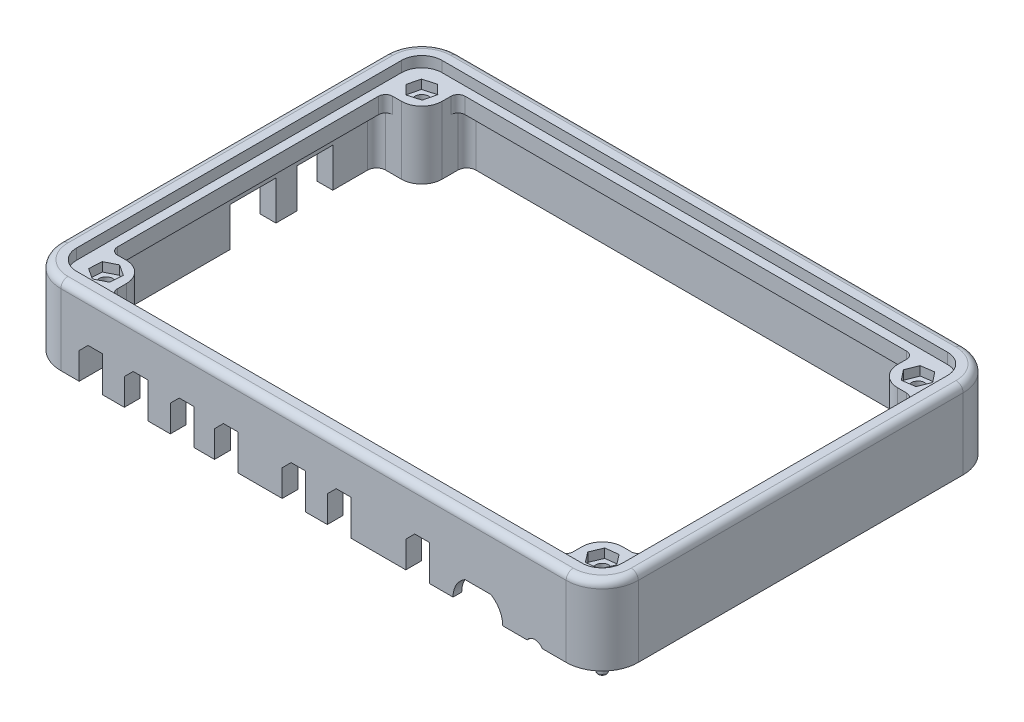
from build123d import *

# Parameters (mm, degrees)
BOSS_EXTRUDE1_DEPTH     = 40
SKETCH2_R               = 2.5
SKETCH2_W               = 6.604
SKETCH2_H               = 16
CUT_EXTRUDE1_DEPTH      = 40
SKETCH3_W               = 10
SKETCH3_H               = 12
SKETCH3_W_2             = 13
CUT_EXTRUDE2_DEPTH      = 40
SKETCH4_W               = 179.476967263
SKETCH4_H               = 26.397125059
CUT_EXTRUDE3_DEPTH      = 120
FILLET1_R               = 2
CUT_EXTRUDE5_DEPTH      = 2.9972
SKETCH6_R               = 1.905
CUT_EXTRUDE6_DEPTH      = 25.8572
SKETCH8_R               = 1.27
BOSS_EXTRUDE2_DEPTH     = 2.5
MIRROR2_COPY_1_SKETCH_R = 1.27
MIRROR2_COPY_1_DEPTH    = 2.5
FILLET2_R               = 0.508
CHAMFER1_SIZE           = 2.5
SKETCH9_W               = 133.938725874
SKETCH9_H               = 2.5
SKETCH9_W_2             = 2.5
SKETCH9_H_2             = 84.886391529
SKETCH9_W_3             = 135.162451748
SKETCH9_H_3             = 84.339912614
BOSS_EXTRUDE3_DEPTH     = 4.5
FILLET3_R               = 2
SKETCH13_W              = 21
SKETCH13_H              = 21
CUT_EXTRUDE7_DEPTH      = 2
CUT_EXTRUDE8_DEPTH      = 2.54


with BuildPart() as part:
    # Sketch1 → Boss-Extrude1 (new body)
    with BuildSketch(Plane(origin=(0, 0, 0), x_dir=(1, 0, 0), z_dir=(0, 1, 0))):
        with BuildLine():
            Line((-71.12, 55.88), (71.12, 55.88))
            ThreePointArc((71.12, 55.88), (78.304204897, 52.904204897), (81.28, 45.72))
            Line((81.28, 45.72), (81.28, -45.72))
            ThreePointArc((81.28, -45.72), (78.304204897, -52.904204897), (71.12, -55.88))
            Line((71.12, -55.88), (-71.12, -55.88))
            ThreePointArc((-71.12, -55.88), (-78.304204897, -52.904204897), (-81.28, -45.72))
            Line((-81.28, -45.72), (-81.28, 45.72))
            ThreePointArc((-81.28, 45.72), (-78.304204897, 52.904204897), (-71.12, 55.88))
        make_face()
    extrude(amount=BOSS_EXTRUDE1_DEPTH)

    # Sketch2 → Cut-Extrude1 (cut)
    with BuildSketch(Plane.XY.offset(55.88)):
        with Locations((62.28, 16.68)):
            Circle(SKETCH2_R)
        with BuildLine():
            Line((42.620513585, 23.965662), (49.944686415, 23.965662))
            ThreePointArc((49.944686415, 23.965662), (46.2826, 11), (42.620513585, 23.965662))
        make_face()
        with Locations((-62.658, 20)):
            Rectangle(SKETCH2_W, SKETCH2_H)
        with Locations((-49.958, 20)):
            Rectangle(SKETCH2_W, SKETCH2_H)
        with Locations((-37.004, 20)):
            Rectangle(SKETCH2_W, SKETCH2_H)
        with Locations((-24.558, 20)):
            Rectangle(SKETCH2_W, SKETCH2_H)
        with Locations((-5.508, 20)):
            Rectangle(SKETCH2_W, SKETCH2_H)
        with Locations((7.192, 20)):
            Rectangle(SKETCH2_W, SKETCH2_H)
        with Locations((29.29, 20)):
            Rectangle(SKETCH2_W, SKETCH2_H)
    extrude(amount=-CUT_EXTRUDE1_DEPTH, mode=Mode.SUBTRACT)

    # Sketch3 → Cut-Extrude2 (cut)
    with BuildSketch(Plane.ZY.offset(81.28)):
        with Locations((-21.38, 23)):
            Rectangle(SKETCH3_W, SKETCH3_H)
        with Locations((-3.88, 23)):
            Rectangle(SKETCH3_W_2, SKETCH3_H)
    extrude(amount=-CUT_EXTRUDE2_DEPTH, mode=Mode.SUBTRACT)

    # Sketch4 → Cut-Extrude3 (cut)
    with BuildSketch(Plane.XY.offset(55.88)):
        with Locations((-1.545647641, 4.80143747)):
            Rectangle(SKETCH4_W, SKETCH4_H)
    extrude(amount=-CUT_EXTRUDE3_DEPTH, mode=Mode.SUBTRACT)

    # Fillet1
    fillet1_edges = [part.edges().sort_by_distance(p)[0] for p in [
        (78.304204897, 40, 52.904204897),
        (81.28, 40, 0),
        (78.304204897, 40, -52.904204897),
        (0, 40, -55.88),
        (-78.304204897, 40, -52.904204897),
        (-81.28, 40, 0),
        (-78.304204897, 40, 52.904204897),
        (0, 40, 55.88),
    ]]
    fillet(fillet1_edges, radius=FILLET1_R)

    # Sketch5 → Cut-Extrude5 (cut)
    with BuildSketch(Plane.XZ.offset(-40)):
        with BuildLine():
            Line((-71.12, 51.435), (71.12, 51.435))
            ThreePointArc((71.12, 51.435), (75.161115254, 49.761115254), (76.835, 45.72))
            Line((76.835, 45.72), (76.835, -45.72))
            ThreePointArc((76.835, -45.72), (75.161115254, -49.761115254), (71.12, -51.435))
            Line((71.12, -51.435), (-71.12, -51.435))
            ThreePointArc((-71.12, -51.435), (-75.161115254, -49.761115254), (-76.835, -45.72))
            Line((-76.835, -45.72), (-76.835, 45.72))
            ThreePointArc((-76.835, 45.72), (-75.161115254, 49.761115254), (-71.12, 51.435))
        make_face()
    extrude(amount=CUT_EXTRUDE5_DEPTH, mode=Mode.SUBTRACT)

    # Sketch6 → Cut-Extrude6 (cut)
    with BuildSketch(Plane(origin=(0, 37.0028, 0), x_dir=(1, 0, 0), z_dir=(0, 1, 0))):
        with Locations(Location((-69.85, 44.45, 0), (0, 0, 270))):
            Circle(SKETCH6_R)
        with Locations(Location((69.85, 44.45, 0), (0, 0, 270))):
            Circle(SKETCH6_R)
        with Locations(Location((69.85, -44.45, 0), (0, 0, 270))):
            Circle(SKETCH6_R)
        with Locations(Location((-69.85, -44.45, 0), (0, 0, 270))):
            Circle(SKETCH6_R)
        with BuildLine():
            Line((-61.595, 51.435), (61.595, 51.435))
            ThreePointArc((61.595, 51.435), (63.391051224, 50.691051224), (64.135, 48.895))
            Line((64.135, 48.895), (64.135, 44.45))
            ThreePointArc((64.135, 44.45), (65.808884746, 40.408884746), (69.85, 38.735))
            Line((69.85, 38.735), (74.295, 38.735))
            ThreePointArc((74.295, 38.735), (76.091051224, 37.991051224), (76.835, 36.195))
            Line((76.835, 36.195), (76.835, -36.195))
            ThreePointArc((76.835, -36.195), (76.091051224, -37.991051224), (74.295, -38.735))
            Line((74.295, -38.735), (69.85, -38.735))
            ThreePointArc((69.85, -38.735), (65.808884746, -40.408884746), (64.135, -44.45))
            Line((64.135, -44.45), (64.135, -48.895))
            ThreePointArc((64.135, -48.895), (63.391051224, -50.691051224), (61.595, -51.435))
            Line((61.595, -51.435), (-61.595, -51.435))
            ThreePointArc((-61.595, -51.435), (-63.391051224, -50.691051224), (-64.135, -48.895))
            Line((-64.135, -48.895), (-64.135, -44.45))
            ThreePointArc((-64.135, -44.45), (-65.808884746, -40.408884746), (-69.85, -38.735))
            Line((-69.85, -38.735), (-74.295, -38.735))
            ThreePointArc((-74.295, -38.735), (-76.091051224, -37.991051224), (-76.835, -36.195))
            Line((-76.835, -36.195), (-76.835, 36.195))
            ThreePointArc((-76.835, 36.195), (-76.091051224, 37.991051224), (-74.295, 38.735))
            Line((-74.295, 38.735), (-69.85, 38.735))
            ThreePointArc((-69.85, 38.735), (-65.808884746, 40.408884746), (-64.135, 44.45))
            Line((-64.135, 44.45), (-64.135, 48.895))
            ThreePointArc((-64.135, 48.895), (-63.391051224, 50.691051224), (-61.595, 51.435))
        make_face()
    extrude(amount=-CUT_EXTRUDE6_DEPTH, mode=Mode.SUBTRACT)

    # Sketch8 → Boss-Extrude2 (add)
    with BuildSketch(Plane.XZ.offset(-18)):
        with Locations(Location((-76.2, 50.8, 0), (0, 0, 90))):
            Circle(SKETCH8_R)
    boss_extrude2 = extrude(amount=BOSS_EXTRUDE2_DEPTH)

    # Mirror1: Boss-Extrude2 across plane
    add(boss_extrude2.mirror(Plane.XY))

    # Mirror2: Boss-Extrude2 across plane
    add(boss_extrude2.mirror(Plane(origin=(0, 0, 0), x_dir=(0, 0, 1), z_dir=(1, 0, 0))))

    # Mirror2 copy 1 sketch → Mirror2 copy 1 (add)
    with BuildSketch(Plane(origin=(0, 18, 0), x_dir=(-1, 0, 0), z_dir=(0, -1, 0))):
        with Locations(Location((-76.2, 50.8, 0), (0, 0, 90))):
            Circle(MIRROR2_COPY_1_SKETCH_R)
    extrude(amount=MIRROR2_COPY_1_DEPTH)

    # Fillet2
    fillet2_edges = [part.edges().sort_by_distance(p)[0] for p in [
        (-76.2, 18, 49.53),
        (-76.2, 15.5, 49.53),
        (-76.2, 15.5, -49.53),
        (-76.2, 18, -49.53),
        (76.2, 15.5, 49.53),
        (76.2, 18, 49.53),
        (76.2, 18, -49.53),
        (76.2, 15.5, -49.53),
    ]]
    fillet(fillet2_edges, radius=FILLET2_R)

    # Chamfer1
    chamfer1_edges = [part.edges().sort_by_distance(p)[0] for p in [
        (-65.96, 28, 48.071610106),
        (-53.26, 28, 53.6575),
        (-40.306, 28, 53.6575),
        (-27.86, 28, 53.6575),
        (-8.81, 28, 53.6575),
        (3.89, 28, 53.6575),
        (25.988, 28, 53.6575),
    ]]
    chamfer(chamfer1_edges, length=CHAMFER1_SIZE)

    # Sketch9 → Boss-Extrude3 (add)
    with BuildSketch(Plane(origin=(0, 37.0028, 0), x_dir=(1, 0, 0), z_dir=(0, 1, 0))):
        with Locations((0.611862937, 50.185)):
            Rectangle(SKETCH9_W, SKETCH9_H)
        with Locations((75.585, -1.457277108)):
            Rectangle(SKETCH9_W_2, SKETCH9_H_2)
        with Locations((0, -50.185)):
            Rectangle(SKETCH9_W_3, SKETCH9_H)
        with Locations((-75.585, 0.455399096)):
            Rectangle(SKETCH9_W_2, SKETCH9_H_3)
    extrude(amount=-BOSS_EXTRUDE3_DEPTH)

    # Fillet3
    # the kernel refuses this fillet: 2 mm, written as the material it adds along each edge
    with BuildSketch(Plane(origin=(-64.13468502, 32.5028, 48.935), x_dir=(1, 0, 0), z_dir=(0, 1, 0))) as fillet3_piece_1:
        with BuildLine():
            CenterArc((1.99968502, 2), FILLET3_R, 180, 90)
            Line((-0.00031498, 2), (-0.20031498, 2))
            ThreePointArc((-0.20031498, 2), (-0.20031498, 0.04), (-0.199975198, -0.003149606))
            Line((-0.199975198, -0.003149606), (0, -0.2))
            Line((0, -0.2), (1.99968502, -0.2))
            Line((1.99968502, -0.2), (1.99968502, 0))
        make_face()
    extrude(amount=4.5)
    with BuildSketch(Plane(origin=(-74.335, 32.5028, 38.73468502), x_dir=(0, 0, -1), z_dir=(0, 1, 0)), Plane(origin=(74.335, 32.5028, -38.73468502), x_dir=(0, 0, 1), z_dir=(0, 1, 0)), Plane(origin=(-64.13468502, 32.5028, -48.935), x_dir=(1, 0, 0), z_dir=(0, 1, 0))) as fillet3_piece_2:
        with BuildLine():
            CenterArc((1.99968502, -2), FILLET3_R, 90, 90)
            Line((-0.00031498, -2), (-0.20031498, -2))
            ThreePointArc((-0.20031498, -2), (-0.20031498, -0.04), (-0.199975198, 0.003149606))
            Line((-0.199975198, 0.003149606), (0, 0.2))
            Line((0, 0.2), (1.99968502, 0.2))
            Line((1.99968502, 0.2), (1.99968502, 0))
        make_face()
    extrude(amount=4.5)
    with BuildSketch(Plane(origin=(64.13468502, 32.5028, 48.935), x_dir=(0.0001574900780178891, 0, -0.9999999875984374), z_dir=(0, 1, 0))) as fillet3_piece_3:
        with BuildLine():
            CenterArc((1.999685045, 1.999999975), FILLET3_R, 180.009023517, 90)
            Line((-0.000314931, 1.999684995), (-0.200314928, 1.999653497))
            Line((-0.200314928, 1.999653497), (-0.199999998, -3.1498e-05))
            Line((-0.199999998, -3.1498e-05), (-0.003118112, -0.199975692))
            ThreePointArc((-0.003118112, -0.199975692), (0.040031547, -0.200308678), (2.000031523, -0.199999998))
            Line((2.000031523, -0.199999998), (2.000000025, 0))
        make_face()
    extrude(amount=4.5)
    with BuildSketch(Plane(origin=(74.335, 32.5028, 38.73468502), x_dir=(-0.9999999875984374, 0, 0.0001574900780178902), z_dir=(0, 1, 0)), Plane(origin=(64.13468502, 32.5028, -48.935), x_dir=(0.0001574900780178891, 0, 0.9999999875984374), z_dir=(0, 1, 0)), Plane(origin=(-74.335, 32.5028, -38.73468502), x_dir=(0.9999999875984374, 0, -0.00015749007801433638), z_dir=(0, 1, 0))) as fillet3_piece_4:
        with BuildLine():
            CenterArc((1.999685045, -1.999999975), FILLET3_R, 89.990976483, 90)
            Line((-0.000314931, -1.999684995), (-0.200314928, -1.999653497))
            Line((-0.200314928, -1.999653497), (-0.199999998, 3.1498e-05))
            Line((-0.199999998, 3.1498e-05), (-0.003118112, 0.199975692))
            ThreePointArc((-0.003118112, 0.199975692), (0.040031547, 0.200308678), (2.000031523, 0.199999998))
            Line((2.000031523, 0.199999998), (2.000000025, 0))
        make_face()
    extrude(amount=4.5)

    # Sketch13 → Cut-Extrude7 (cut)
    with BuildSketch(Plane(origin=(0, 0, 51.435), x_dir=(-1, 0, 0), z_dir=(0, 0, -1))):
        with Locations((-46.2826, 18)):
            Rectangle(SKETCH13_W, SKETCH13_H)
    extrude(amount=-CUT_EXTRUDE7_DEPTH, mode=Mode.SUBTRACT)

    # Sketch14 → Cut-Extrude8 (cut)
    with BuildSketch(Plane(origin=(0, 37.0028, 0), x_dir=(1, 0, 0), z_dir=(0, 1, 0))):
        Polygon((-67.226757799, 41.930357098), (-66.356304138, 45.461972936), (-68.979546339, 47.981615838), (-72.473242201, 46.969642902), (-73.343695862, 43.438027064), (-70.720453661, 40.918384162), align=None)
        Polygon((72.106364915, 41.59713874), (73.448832782, 44.977638707), (71.192467867, 47.830499967), (67.593635085, 47.30286126), (66.251167218, 43.922361293), (68.507532133, 41.069500033), align=None)
        Polygon((72.049498726, -47.346930333), (73.458564624, -43.993643395), (71.259065899, -41.096713061), (67.650501274, -41.553069667), (66.241435376, -44.906356605), (68.440934101, -47.803286939), align=None)
        Polygon((-66.811339272, -46.449135058), (-66.59936789, -42.818010145), (-69.638028618, -40.818875087), (-72.888660728, -42.450864942), (-73.10063211, -46.081989855), (-70.061971382, -48.081124913), align=None)
    extrude(amount=-CUT_EXTRUDE8_DEPTH, mode=Mode.SUBTRACT)


solid = part.part
